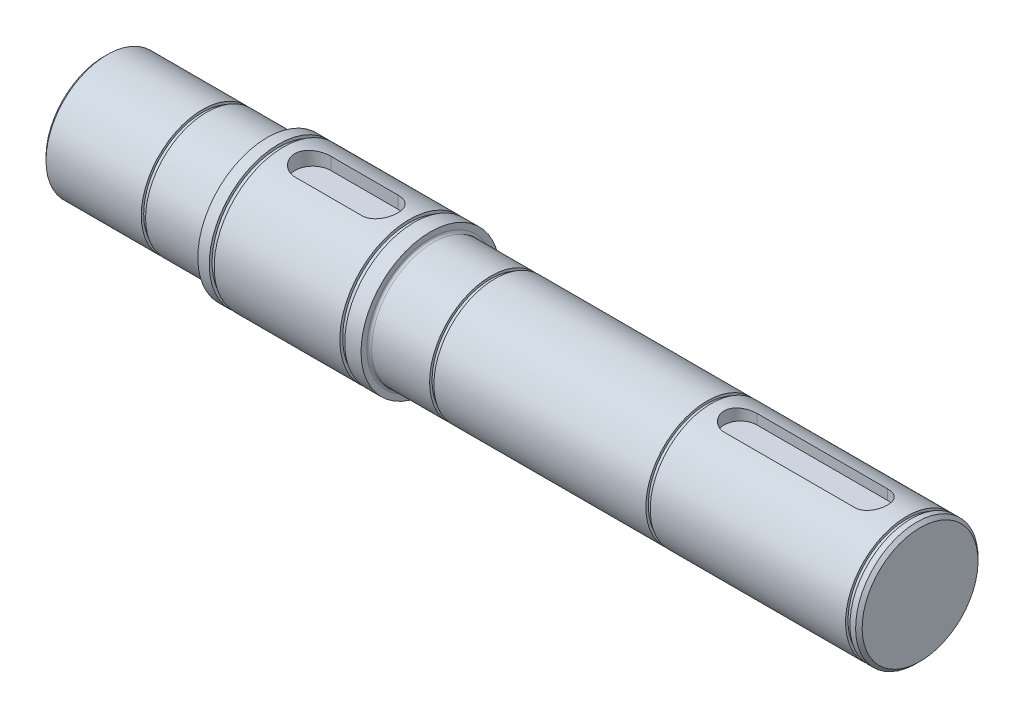
from build123d import *

# Parameters (mm, degrees)
ESQUISSE2_R              = 42.5
ESQUISSE2_R_2            = 40.75
ENL_V_MAT_EXTRU_1_DEPTH  = 3
ESQUISSE3_R              = 42.5
ESQUISSE3_R_2            = 40.75
ENL_V_MAT_EXTRU_2_DEPTH  = 3
ENL_V_MAT_EXTRU_3_DEPTH  = 9
ENL_V_MAT_EXTRU_4_DEPTH  = 7.5
CHANFREIN1_SIZE          = 2
ESQUISSE6_R              = 37.5
ESQUISSE6_R_2            = 36
ENL_V_MAT_EXTRU_5_DEPTH  = 2.65
ENL_V_START              = -2.65
ESQUISSE7_R              = 37.5
ESQUISSE7_R_2            = 36
ENL_V_MAT_EXTRU_6_DEPTH  = 2.65
ESQUISSE8_R              = 37.5
ESQUISSE8_R_2            = 36
ENL_V_MAT_EXTRU_7_DEPTH  = 2.65
ENL_V_START_2            = 2.65
ESQUISSE10_R             = 37.5
ESQUISSE10_R_2           = 36
ENL_V_MAT_EXTRU_11_DEPTH = 2.65


with BuildPart() as part:
    # Esquisse1 → Révolution1 (revolve)
    with BuildSketch(Plane.XY):
        with BuildLine():
            Line((0, 0), (0, 37.5))
            Line((0, 37.5), (98.5, 37.5))
            ThreePointArc((98.5, 37.5), (99.560660172, 37.939339828), (100, 39))
            Line((100, 39), (100, 42.5))
            Line((100, 42.5), (200, 42.5))
            Line((200, 42.5), (200, 39))
            ThreePointArc((200, 39), (200.439339828, 37.939339828), (201.5, 37.5))
            Line((201.5, 37.5), (500, 37.5))
            Line((500, 37.5), (500, 0))
            Line((500, 0), (0, 0))
        make_face()
    revolve(axis=Axis((500, 0, 0), (-1, 0, 0)))

    # Esquisse2 → Enlèv. mat.-Extru.1 (cut)
    with BuildSketch(Plane(origin=(110, 0, 0), x_dir=(0, 0, -1), z_dir=(1, 0, 0))):
        Circle(ESQUISSE2_R)
        Circle(ESQUISSE2_R_2, mode=Mode.SUBTRACT)
    extrude(amount=-ENL_V_MAT_EXTRU_1_DEPTH, mode=Mode.SUBTRACT)

    # Esquisse3 → Enlèv. mat.-Extru.2 (cut)
    with BuildSketch(Plane(origin=(190, 0, 0), x_dir=(0, 0, -1), z_dir=(1, 0, 0))):
        Circle(ESQUISSE3_R)
        Circle(ESQUISSE3_R_2, mode=Mode.SUBTRACT)
    extrude(amount=-ENL_V_MAT_EXTRU_2_DEPTH, mode=Mode.SUBTRACT)

    # Esquisse4 → Enlèv. mat.-Extru.3 (cut)
    with BuildSketch(Plane(origin=(0, 42.5, 0), x_dir=(1, 0, 0), z_dir=(0, 1, 0))):
        with BuildLine():
            Line((128, 11), (169, 11))
            ThreePointArc((169, 11), (180, 0), (169, -11))
            Line((169, -11), (128, -11))
            ThreePointArc((128, -11), (117, 0), (128, 11))
        make_face()
    extrude(amount=-ENL_V_MAT_EXTRU_3_DEPTH, mode=Mode.SUBTRACT)

    # Esquisse5 → Enlèv. mat.-Extru.4 (cut)
    with BuildSketch(Plane(origin=(0, 37.5, 0), x_dir=(1, 0, 0), z_dir=(0, 1, 0))):
        with BuildLine():
            Line((470, -10), (390, -10))
            ThreePointArc((390, -10), (380, 0), (390, 10))
            Line((390, 10), (470, 10))
            ThreePointArc((470, 10), (480, 0), (470, -10))
        make_face()
    extrude(amount=-ENL_V_MAT_EXTRU_4_DEPTH, mode=Mode.SUBTRACT)

    # Chanfrein1
    chanfrein1_edges = [part.edges().sort_by_distance(p)[0] for p in [
        (500, -37.5, 0),
        (0, -37.5, 0),
    ]]
    chamfer(chanfrein1_edges, length=CHANFREIN1_SIZE)

    # Esquisse6 → Enlèv. mat.-Extru.5 (cut)
    with BuildSketch(Plane(origin=(494.5, 0, 0), x_dir=(0, 0, -1), z_dir=(1, 0, 0))):
        Circle(ESQUISSE6_R)
        Circle(ESQUISSE6_R_2, mode=Mode.SUBTRACT)
    extrude(amount=-ENL_V_MAT_EXTRU_5_DEPTH, mode=Mode.SUBTRACT)

    # Esquisse7 → Enlèv. mat.-Extru.6 (cut)
    with BuildSketch(Plane.ZY.offset(-60.35).offset(ENL_V_START)):
        Circle(ESQUISSE7_R)
        Circle(ESQUISSE7_R_2, mode=Mode.SUBTRACT)
    extrude(amount=ENL_V_MAT_EXTRU_6_DEPTH, mode=Mode.SUBTRACT)

    # Esquisse8 → Enlèv. mat.-Extru.7 (cut)
    with BuildSketch(Plane.ZY.offset(-239.65)):
        Circle(ESQUISSE8_R)
        Circle(ESQUISSE8_R_2, mode=Mode.SUBTRACT)
    extrude(amount=ENL_V_MAT_EXTRU_7_DEPTH, mode=Mode.SUBTRACT)

    # Esquisse10 → Enlèv. mat.-Extru.11 (cut)
    with BuildSketch(Plane(origin=(369.5, 0, 0), x_dir=(0, 0, -1), z_dir=(1, 0, 0)).offset(ENL_V_START_2)):
        Circle(ESQUISSE10_R)
        Circle(ESQUISSE10_R_2, mode=Mode.SUBTRACT)
    extrude(amount=-ENL_V_MAT_EXTRU_11_DEPTH, mode=Mode.SUBTRACT)


solid = part.part
